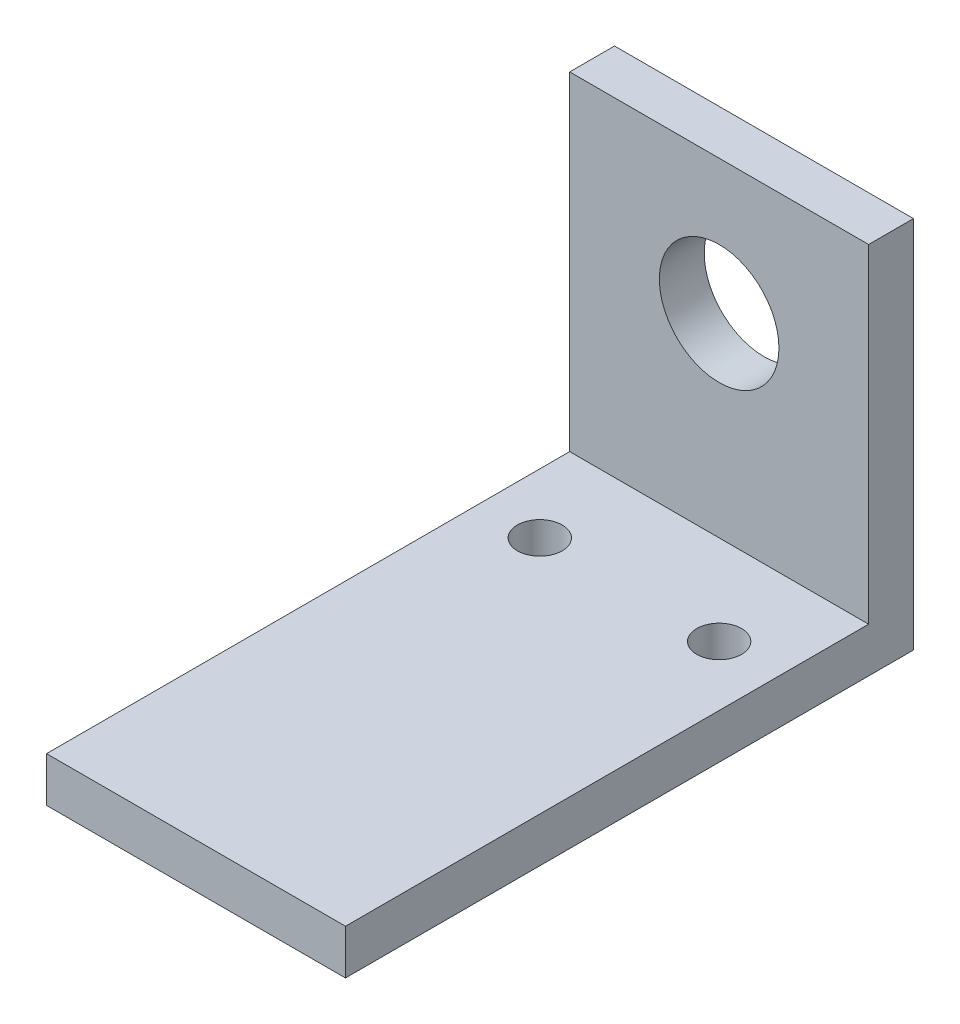
from build123d import *

# Parameters (mm, degrees)
EXTRUDE_1_DEPTH     = 20
CUT_EXTRUDE_1_REACH = 47.924
SKETCH_2_R          = 4
CUT_EXTRUDE_2_REACH = 47.924
SKETCH_3_R          = 1.5


with BuildPart() as part:
    # 草图1 → 凸台-拉伸1 (new body)
    with BuildSketch(Plane(origin=(0, 0, 0), x_dir=(0, 0, -1), z_dir=(1, 0, 0))):
        Polygon((0, 0), (0, 22), (3, 22), (3, -3), (-35, -3), (-35, 0), align=None)
    extrude(amount=EXTRUDE_1_DEPTH)

    # 草图2 → 切除-拉伸1 (cut, up to next)
    with BuildSketch(Plane.XY, mode=Mode.PRIVATE) as cut_extrude_1_sk1:
        with Locations((10, 13)):
            Circle(SKETCH_2_R)
    cut_extrude_1_tool1 = extrude(cut_extrude_1_sk1.sketch, amount=-CUT_EXTRUDE_1_REACH, mode=Mode.PRIVATE) & part.part
    add(cut_extrude_1_tool1.solids().sort_by_distance((10, 13, 0))[0], mode=Mode.SUBTRACT)

    # 草图3 → 切除-拉伸2 (cut, up to next)
    with BuildSketch(Plane(origin=(0, 0, 0), x_dir=(1, 0, 0), z_dir=(0, 1, 0)), mode=Mode.PRIVATE) as cut_extrude_2_sk1:
        with Locations((4, -6)):
            Circle(SKETCH_3_R)
    cut_extrude_2_tool1 = extrude(cut_extrude_2_sk1.sketch, amount=-CUT_EXTRUDE_2_REACH, mode=Mode.PRIVATE) & part.part
    # 草图3 → 切除-拉伸2 (cut, up to next)
    with BuildSketch(Plane(origin=(0, 0, 0), x_dir=(1, 0, 0), z_dir=(0, 1, 0)), mode=Mode.PRIVATE) as cut_extrude_2_sk2:
        with Locations((16, -6)):
            Circle(SKETCH_3_R)
    cut_extrude_2_tool2 = extrude(cut_extrude_2_sk2.sketch, amount=-CUT_EXTRUDE_2_REACH, mode=Mode.PRIVATE) & part.part
    add(cut_extrude_2_tool1.solids().sort_by_distance((4, 0, 6))[0], mode=Mode.SUBTRACT)
    add(cut_extrude_2_tool2.solids().sort_by_distance((16, 0, 6))[0], mode=Mode.SUBTRACT)


solid = part.part
